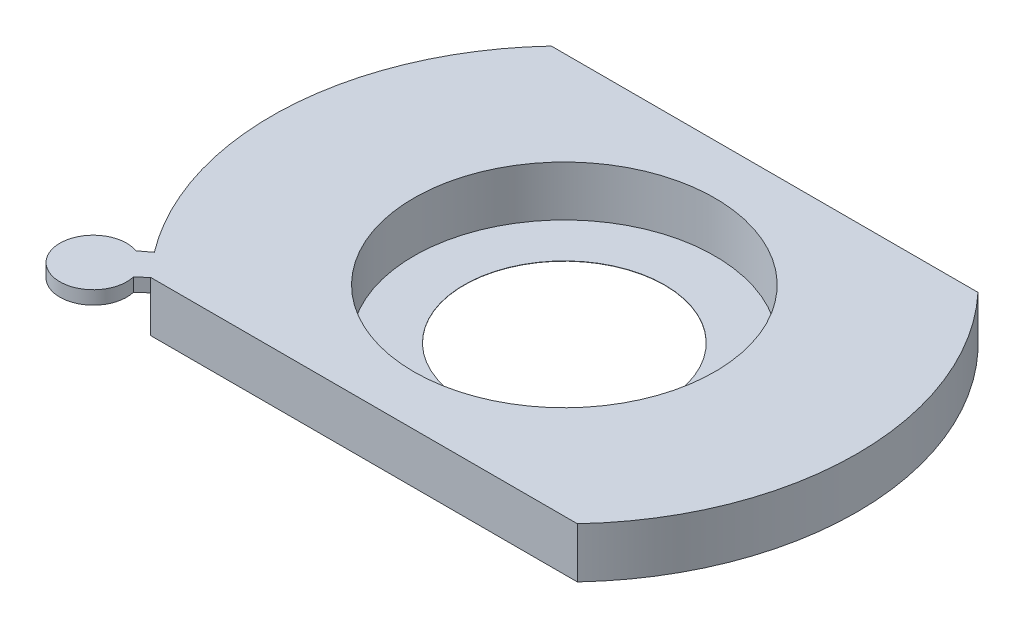
from build123d import *

# Parameters (mm, degrees)
SKETCH1_R                = 1750
BOSS_EXTRUDE1_DEPTH      = 500
SKETCH2_R                = 900
CUT_EXTRUDE2_DEPTH       = 300
CUT_EXTRUDE10_DEPTH      = 2525.876234591
CUT_EXTRUDE10_DEPTH_BACK = 2525.876234591
SKETCH9_W                = 5273.235769222
SKETCH9_H                = 4165.824449254
SKETCH9_W_2              = 4212.623718326
SKETCH9_H_2              = 2396.11984
SKETCH3_R                = 600
CUT_EXTRUDE3_DEPTH       = 300
SHELL1_T                 = -1.5
SKETCH10_W               = 4453.085199548
SKETCH10_H               = 3102.078328882
CUT_EXTRUDE11_DEPTH      = 2143.136742113
BOSS_EXTRUDE2_START      = -80
BOSS_EXTRUDE2_DEPTH      = 80


with BuildPart() as part:
    # Sketch1 → Boss-Extrude1 (new body)
    with BuildSketch(Plane(origin=(0, 0, 0), x_dir=(1, 0, 0), z_dir=(0, 1, 0))):
        Circle(SKETCH1_R)
    extrude(amount=BOSS_EXTRUDE1_DEPTH)

    # Sketch2 → Cut-Extrude2 (cut)
    with BuildSketch(Plane(origin=(0, 500, 0), x_dir=(1, 0, 0), z_dir=(0, 1, 0))):
        Circle(SKETCH2_R)
    extrude(amount=-CUT_EXTRUDE2_DEPTH, mode=Mode.SUBTRACT)

    # Sketch9 → Cut-Extrude10 (cut, two sides: drawn at the far end of the back side and taken through both)
    with BuildSketch(Plane.XZ.offset(-CUT_EXTRUDE10_DEPTH_BACK)):
        Rectangle(SKETCH9_W, SKETCH9_H)
        Rectangle(SKETCH9_W_2, SKETCH9_H_2, mode=Mode.SUBTRACT)
    extrude(amount=CUT_EXTRUDE10_DEPTH + CUT_EXTRUDE10_DEPTH_BACK, mode=Mode.SUBTRACT)

    # Sketch3 → Cut-Extrude3 (cut)
    with BuildSketch(Plane.XZ):
        Circle(SKETCH3_R)
    extrude(amount=-CUT_EXTRUDE3_DEPTH, mode=Mode.SUBTRACT)

    # Shell1
    shell1_openings = [part.faces().sort_by_distance(p)[0] for p in [
        (1707.583740986, 0, 0),
    ]]
    offset(amount=SHELL1_T, openings=shell1_openings, kind=Kind.INTERSECTION)

    # Sketch10 → Cut-Extrude11 (cut, through all)
    with BuildSketch(Plane.XZ.offset(-198.5)):
        Rectangle(SKETCH10_W, SKETCH10_H)
    extrude(amount=CUT_EXTRUDE11_DEPTH, mode=Mode.SUBTRACT)

    # Sketch12 → Boss-Extrude2 (add)
    with BuildSketch(Plane(origin=(0, 500, 0), x_dir=(1, 0, 0), z_dir=(0, 1, 0)).offset(BOSS_EXTRUDE2_START)):
        with BuildLine():
            Line((-1329.427366657, -1248.362496346), (-1275.720428066, -1197.93046101))
            ThreePointArc((-1275.720428066, -1197.93046101), (-1337.090701529, -1129.021016582), (-1394.743394808, -1056.972498526))
            Line((-1394.743394808, -1056.972498526), (-1456.886660309, -1104.066267063))
            ThreePointArc((-1456.886660309, -1104.066267063), (-1674.443216413, -1424.679230146), (-1329.427366657, -1248.362496346))
        make_face()
    extrude(amount=BOSS_EXTRUDE2_DEPTH)


solid = part.part
